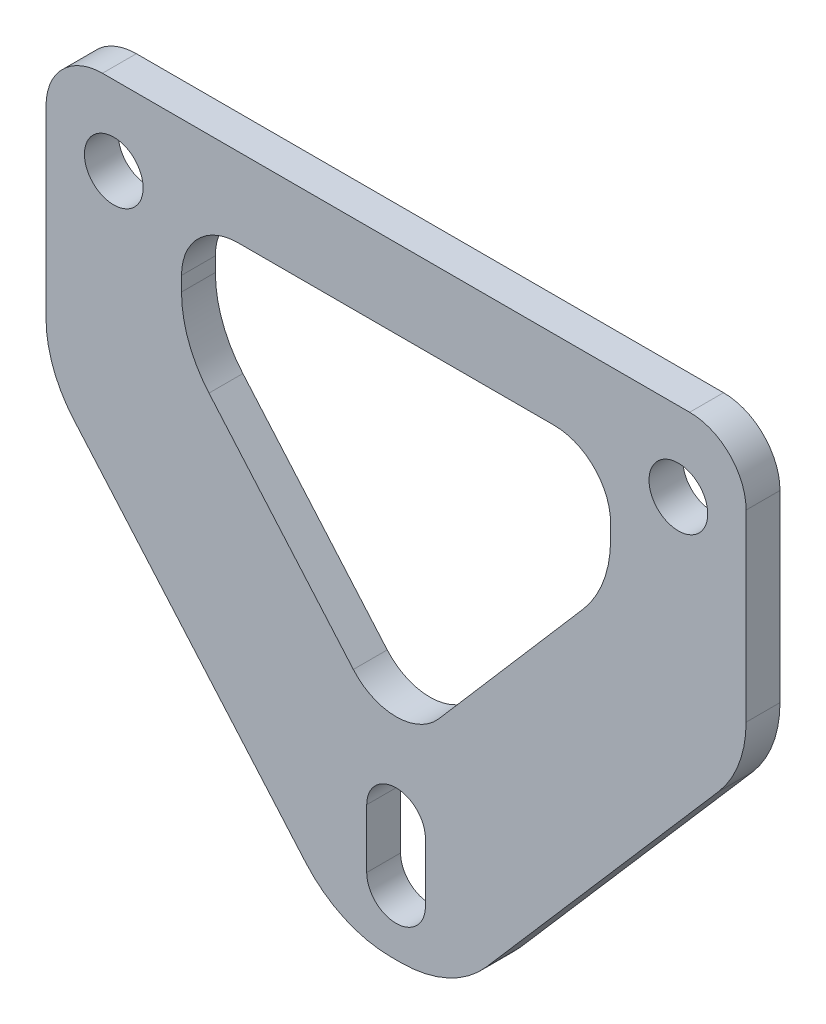
from build123d import *

# Parameters (mm, degrees)
SKETCH1_R          = 2.6
BASE_FLANGE1_DEPTH = 3
FILLET_10_MM_R     = 10
FILLET_5_MM_R      = 5


# Sheet-metal steps are written as plain solids
with BuildPart() as part:
    # Sketch1 → Base-Flange1 (new body)
    with BuildSketch(Plane.XY):
        Polygon((-31, -0.559405941), (31, -0.559405941), (31, -25.559405941), (5, -55.559405941), (-5, -55.559405941), (-31, -25.559405941), align=None)
        with Locations((25, -7.559405941)):
            Circle(SKETCH1_R, mode=Mode.SUBTRACT)
        with Locations((-25, -7.559405941)):
            Circle(SKETCH1_R, mode=Mode.SUBTRACT)
        with BuildLine():
            Line((-2.6, -50.159405941), (-2.6, -44.959405941))
            ThreePointArc((-2.6, -44.959405941), (0, -42.359405941), (2.6, -44.959405941))
            Line((2.6, -44.959405941), (2.6, -50.159405941))
            ThreePointArc((2.6, -50.159405941), (0, -52.759405941), (-2.6, -50.159405941))
        make_face(mode=Mode.SUBTRACT)
        Polygon((0, -39.559405941), (19, -17.559405941), (19, -7.559405941), (-19, -7.559405941), (-19, -17.559405941), align=None, mode=Mode.SUBTRACT)
    extrude(amount=-BASE_FLANGE1_DEPTH)

    # fillet 10 mm
    fillet_10_mm_edges = [part.edges().sort_by_distance(p)[0] for p in [
        (31, -25.559405941, -1.5),
        (5, -55.559405941, -1.5),
        (-5, -55.559405941, -1.5),
        (-31, -25.559405941, -1.5),
        (-19, -17.559405941, -1.5),
        (19, -17.559405941, -1.5),
    ]]
    fillet(fillet_10_mm_edges, radius=FILLET_10_MM_R)

    # fillet 5 mm
    fillet_5_mm_edges = [part.edges().sort_by_distance(p)[0] for p in [
        (-31, -0.559405941, -1.5),
        (31, -0.559405941, -1.5),
        (0, -39.559405941, -1.5),
        (-19, -7.559405941, -1.5),
        (19, -7.559405941, -1.5),
    ]]
    fillet(fillet_5_mm_edges, radius=FILLET_5_MM_R)


solid = part.part
